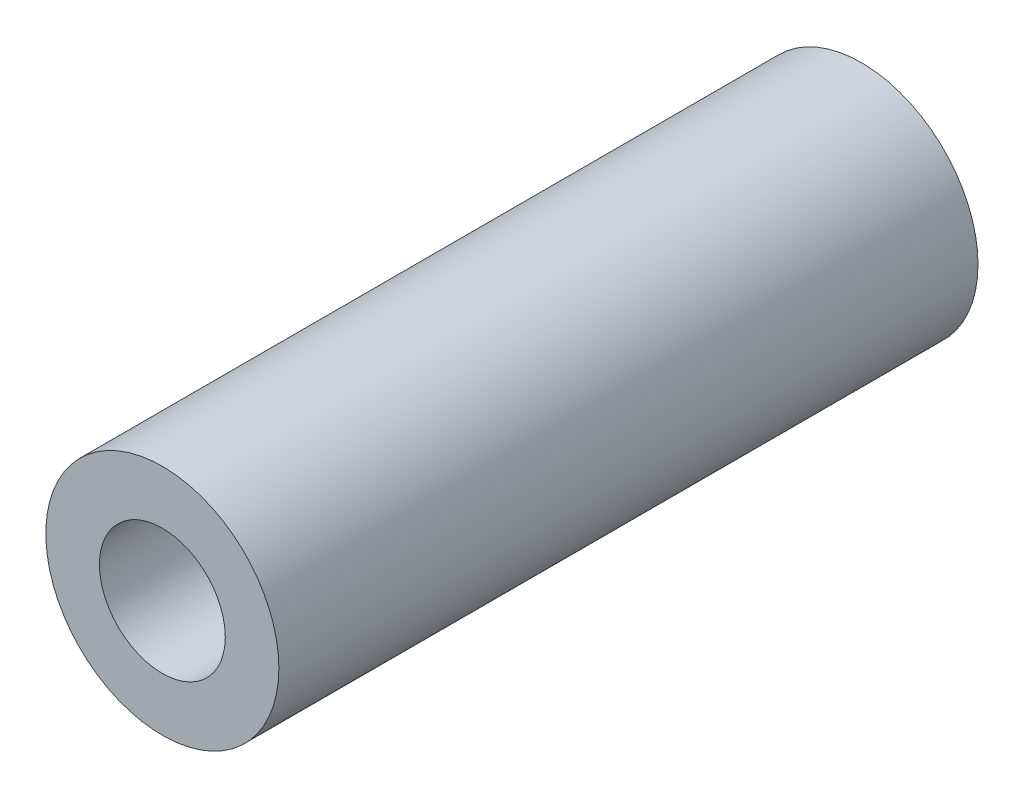
from build123d import *

# Parameters (mm, degrees)
CROQUIS1_R                     = 2.5
SALIENTE_EXTRUIR1_DEPTH        = 15
TALADRO_DE_MARGEN_PARA_M2_51_D = 2.7


with BuildPart() as part:
    # Croquis1 → Saliente-Extruir1 (new body)
    with BuildSketch(Plane.XY):
        Circle(CROQUIS1_R)
    extrude(amount=SALIENTE_EXTRUIR1_DEPTH)

    # Taladro de margen para M2.51 (through all)
    with Locations(Plane.XY.offset(15)):
        with Locations((0, 0)):
            Hole(TALADRO_DE_MARGEN_PARA_M2_51_D / 2)


solid = part.part
